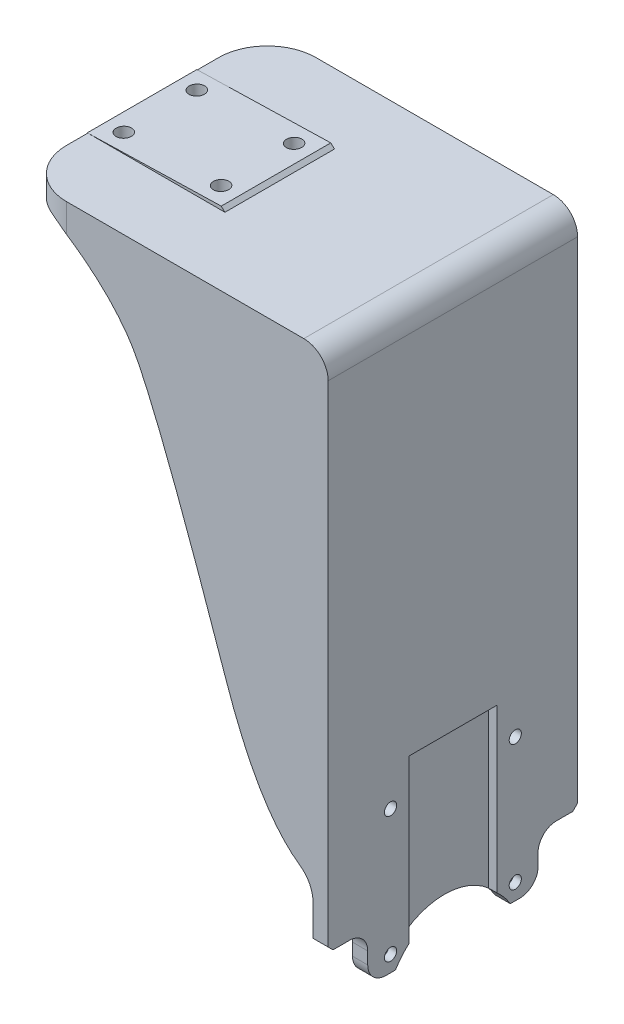
from build123d import *

# Parameters (mm, degrees)
SKETCH_1_W          = 51
SKETCH_1_H          = 41
EXTRUDE_1_DEPTH     = 3.4
SKETCH_2_R          = 1
EXTRUDE_2_DEPTH     = 2.5
SKETCH_3_W          = 14.5
SKETCH_3_H          = 45.737354226
CUT_EXTRUDE_1_DEPTH = 1.4
EXTRUDE_4_DEPTH     = 2
FILLET_1_R          = 8
FILLET_2_R          = 4
SKETCH_6_R          = 2
CUT_EXTRUDE_2_DEPTH = 1.2
CUT_EXTRUDE_3_DEPTH = 4
FILLET_3_R          = 3
SKETCH_9_R          = 2
CUT_EXTRUDE_4_DEPTH = 0.8
CHAMFER_1_SIZE      = 0.8
FILLET_4_R          = 4
FILLET_5_R          = 5
SKETCH_11_W         = 18
SKETCH_11_H         = 22
EXTRUDE_5_DEPTH     = 1
SKETCH_12_W         = 22
SKETCH_12_H         = 18
EXTRUDE_6_DEPTH     = 1
SKETCH_13_R         = 1.25
CUT_EXTRUDE_5_DEPTH = 96.476563316
SKETCH_14_R         = 2.5
CUT_EXTRUDE_6_DEPTH = 1
CHAMFER_START       = -9
CHAMFER_2_DEPTH     = 18
SKETCH_15_W         = 20
SKETCH_15_H         = 41
EXTRUDE_7_DEPTH     = 2


with BuildPart() as part:
    # 草图1 → 凸台-拉伸1 (new body)
    with BuildSketch(Plane(origin=(0, 0, 0), x_dir=(1, 0, 0), z_dir=(0, 1, 0))):
        Rectangle(SKETCH_1_W, SKETCH_1_H)
    extrude(amount=EXTRUDE_1_DEPTH)

    # 草图2 → 凸台-拉伸2 (add)
    with BuildSketch(Plane(origin=(25.5, 0, 0), x_dir=(0, 0, -1), z_dir=(1, 0, 0))):
        with BuildLine():
            Line((-20.5, 0), (20.5, 0))
            Line((20.5, 0), (20.5, -90))
            Line((20.5, -90), (9.43808773, -90))
            ThreePointArc((9.43808773, -90), (0, -84.65), (-9.43808773, -90))
            Line((-9.43808773, -90), (-20.5, -90))
            Line((-20.5, -90), (-20.5, 0))
        make_face()
        with Locations((-10.25, -87.35)):
            Circle(SKETCH_2_R, mode=Mode.SUBTRACT)
        with Locations(Location((10.25, -87.35, 0), (0, 0, 180))):
            Circle(SKETCH_2_R, mode=Mode.SUBTRACT)
        with Locations((10.25, -66.65)):
            Circle(SKETCH_2_R, mode=Mode.SUBTRACT)
        with Locations(Location((-10.25, -66.65, 0), (0, 0, 180))):
            Circle(SKETCH_2_R, mode=Mode.SUBTRACT)
    extrude(amount=-EXTRUDE_2_DEPTH)

    # 草图3 → 切除-拉伸1 (cut)
    with BuildSketch(Plane(origin=(25.5, 0, 0), x_dir=(0, 0, -1), z_dir=(1, 0, 0))):
        with Locations((0, -83.518677113)):
            Rectangle(SKETCH_3_W, SKETCH_3_H)
    extrude(amount=-CUT_EXTRUDE_1_DEPTH, mode=Mode.SUBTRACT)

    # 草图5 → 凸台-拉伸4 (add)
    with BuildSketch(Plane(origin=(0, 0, -20.5), x_dir=(-1, 0, 0), z_dir=(0, 0, -1))):
        with BuildLine():
            Line((-25.5, 3.4), (19.5, 3.4))
            Line((19.5, 3.4), (19.5, 0))
            add(Edge.make_bspline(
                [(19.5, 0), (10.67122189, -5.3692624), (2.779429236, -18.193392293), (-14.958428672, -69.683085372), (-23, -73.07523223)],
                knots=[0, 0, 0, 0.396049025, 0.788579615, 1, 1, 1], degree=2))
            Line((-23, -73.07523223), (-25.5, -73.07523223))
            Line((-25.5, -73.07523223), (-25.5, 3.4))
        make_face()
    extrude_4 = extrude(amount=-EXTRUDE_4_DEPTH)

    # 镜向3: 凸台-拉伸4 across plane
    add(extrude_4.mirror(Plane.XY))

    # 圆角1
    fillet_1_edges = [part.edges().sort_by_distance(p)[0] for p in [
        (-25.5, 1.7, -20.5),
        (-25.5, 1.7, 20.5),
    ]]
    fillet(fillet_1_edges, radius=FILLET_1_R)

    # 圆角2
    fillet_2_edges = [part.edges().sort_by_distance(p)[0] for p in [
        (25.5, 3.4, 0),
        (23, 0, 0),
    ]]
    fillet(fillet_2_edges, radius=FILLET_2_R)

    # 草图6 → 切除-拉伸2 (cut)
    with BuildSketch(Plane.ZY.offset(-23)):
        with Locations((10.25, -87.35)):
            Circle(SKETCH_6_R)
        with Locations((-10.25, -87.35)):
            Circle(SKETCH_6_R)
    extrude(amount=-CUT_EXTRUDE_2_DEPTH, mode=Mode.SUBTRACT)

    # 草图8 → 切除-拉伸3 (cut)
    with BuildSketch(Plane(origin=(25.5, 0, 0), x_dir=(0, 0, -1), z_dir=(1, 0, 0))):
        Polygon((14, -102.818047241), (14, -82), (23.468492482, -82), (23.468492482, -110.008191191), (-23.468492482, -110.008191191), (-23.468492482, -82), (-14, -82), (-14, -102.818047241), align=None)
    extrude(amount=-CUT_EXTRUDE_3_DEPTH, mode=Mode.SUBTRACT)

    # 圆角3
    fillet_3_edges = [part.edges().sort_by_distance(p)[0] for p in [
        (24.25, -90, 14),
        (24.25, -90, -14),
        (24.25, -82, -14),
        (24.25, -82, 14),
    ]]
    fillet(fillet_3_edges, radius=FILLET_3_R)

    # 草图9 → 切除-拉伸4 (cut)
    with BuildSketch(Plane.ZY.offset(-23)):
        with Locations((10.25, -66.65)):
            Circle(SKETCH_9_R)
        with Locations(Location((-10.25, -66.65, 0), (0, 0, 180))):
            Circle(SKETCH_9_R)
    extrude(amount=-CUT_EXTRUDE_4_DEPTH, mode=Mode.SUBTRACT)

    # 倒角1
    chamfer_1_edges = [part.edges().sort_by_distance(p)[0] for p in [
        (24.25, -82, 20.5),
        (24.25, -82, -20.5),
    ]]
    chamfer(chamfer_1_edges, length=CHAMFER_1_SIZE)

    # 圆角4
    fillet_4_edges = [part.edges().sort_by_distance(p)[0] for p in [
        (-0.25, 0, -18.5),
        (21.828427125, -1.171572875, -18.5),
        (-0.25, 0, 18.5),
        (21.828427125, -1.171572875, 18.5),
        (23, -38.537616115, -18.5),
        (23, -38.537616115, 18.5),
    ]]
    fillet(fillet_4_edges, radius=FILLET_4_R)

    # 圆角5
    fillet_5_edges = [part.edges().sort_by_distance(p)[0] for p in [
        (23, -73.07523223, 16.5),
        (23, -73.07523223, -16.5),
        (-19.5, 0, 16.5),
        (-19.5, 0, -16.5),
    ]]
    fillet(fillet_5_edges, radius=FILLET_5_R)

    # 草图11 → 凸台-拉伸5 (add)
    with BuildSketch(Plane(origin=(-0.017473432, 0.667283442, 0), x_dir=(0, 0, 1), z_dir=(0.02617694830787321, -0.9996573249755574, 0))):
        with Locations((0, 14.491261787)):
            Rectangle(SKETCH_11_W, SKETCH_11_H)
    extrude(amount=EXTRUDE_5_DEPTH)

    # 草图12 → 凸台-拉伸6 (add)
    with BuildSketch(Plane(origin=(-0.106444557, 4.064953651, 0), x_dir=(-0.9996573249755574, -0.026176948307873222, 0), z_dir=(0.02617694830787322, -0.9996573249755573, 0))):
        with Locations((14.491261787, 0)):
            Rectangle(SKETCH_12_W, SKETCH_12_H)
    extrude(amount=EXTRUDE_6_DEPTH)

    # 草图13 → 切除-拉伸5 (cut, through all)
    with BuildSketch(Plane(origin=(0.008703516, -0.332373883, 0), x_dir=(0.9996573249755574, 0.02617694830787322, 0), z_dir=(0.026176948307873215, -0.9996573249755573, 0))):
        with Locations((-22.491261787, 6)):
            Circle(SKETCH_13_R)
        with Locations((-22.491261787, -6)):
            Circle(SKETCH_13_R)
        with Locations((-6.491261787, -6)):
            Circle(SKETCH_13_R)
        with Locations((-6.491261787, 6)):
            Circle(SKETCH_13_R)
    extrude(amount=-CUT_EXTRUDE_5_DEPTH, mode=Mode.SUBTRACT)

    # 草图14 → 切除-拉伸6 (cut)
    with BuildSketch(Plane(origin=(0.008703516, -0.332373883, 0), x_dir=(-0.9996573249755574, -0.02617694830787322, 0), z_dir=(0.026176948307873215, -0.9996573249755573, 0))):
        with Locations(Location((22.491261787, -6, 0), (0, 0, 180))):
            Circle(SKETCH_14_R)
        with Locations(Location((6.491261787, -6, 0), (0, 0, 180))):
            Circle(SKETCH_14_R)
        with Locations(Location((6.491261787, 6, 0), (0, 0, 180))):
            Circle(SKETCH_14_R)
        with Locations(Location((22.491261787, 6, 0), (0, 0, 180))):
            Circle(SKETCH_14_R)
    extrude(amount=-CUT_EXTRUDE_6_DEPTH, mode=Mode.SUBTRACT)

    # 倒角2: read off the stored shape, not the designer's step
    # 倒角2 outline → 倒角2 (add)
    with BuildSketch(Plane.XY.offset(CHAMFER_START)):
        Polygon((-2.965145455, 3.4), (-3.570278653, 3.974249963), (-3.596509976, 3.973563072), (-3.581490699, 3.4), align=None)
    extrude(amount=CHAMFER_2_DEPTH)

    # 草图15 → 凸台-拉伸7 (add)
    with BuildSketch(Plane(origin=(0, -40, 0), x_dir=(-1, 0, 0), z_dir=(0, -1, 0))):
        with Locations((-15.5, 0)):
            Rectangle(SKETCH_15_W, SKETCH_15_H)
    extrude(amount=-EXTRUDE_7_DEPTH)


solid = part.part
